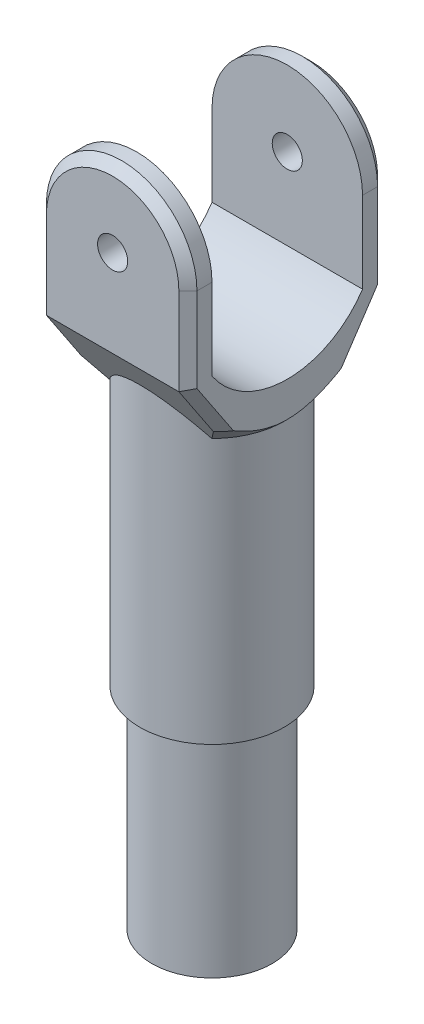
from build123d import *

# Parameters (mm, degrees)
SKETCH1_R               = 50
BOSS_EXTRUDE1_DEPTH     = 175
SKETCH4_R               = 60
BOSS_EXTRUDE3_DEPTH     = 250
BOSS_EXTRUDE4_DEPTH     = 62.5
CUT_EXTRUDE2_DEPTH      = 616.817546031
CUT_EXTRUDE2_DEPTH_BACK = 616.817546031
SKETCH6_R               = 12.5
CHAMFER2_SIZE           = 30
CHAMFER3_SIZE           = 7.5
CUT_EXTRUDE3_DEPTH      = 609.712781203
CUT_EXTRUDE3_DEPTH_BACK = 609.712781203


with BuildPart() as part:
    # Sketch1 → Boss-Extrude1 (new body)
    with BuildSketch(Plane(origin=(0, 0, 0), x_dir=(1, 0, 0), z_dir=(0, 1, 0))):
        with Locations(Location((0, 0, 0), (0, 0, 270))):
            Circle(SKETCH1_R)
    extrude(amount=BOSS_EXTRUDE1_DEPTH)

    # Sketch4 → Boss-Extrude3 (add)
    with BuildSketch(Plane(origin=(0, 175, 0), x_dir=(1, 0, 0), z_dir=(0, 1, 0))):
        with Locations(Location((0, 0, 0), (0, 0, 270))):
            Circle(SKETCH4_R)
    extrude(amount=BOSS_EXTRUDE3_DEPTH)

    # Sketch5 → Boss-Extrude4 (add, symmetric)
    with BuildSketch(Plane(origin=(0, 0, 0), x_dir=(0, 0, -1), z_dir=(1, 0, 0))):
        Polygon((-62.5, 425), (62.5, 425), (82.5, 455), (82.5, 590), (62.5, 590), (62.5, 460), (-62.5, 460), (-62.5, 590), (-82.5, 590), (-82.5, 455), align=None)
    extrude(amount=BOSS_EXTRUDE4_DEPTH, both=True)

    # Sketch6 → Cut-Extrude2 (cut, two sides: drawn at the far end of the back side and taken through both)
    with BuildSketch(Plane.XY.offset(82.5).offset(-CUT_EXTRUDE2_DEPTH_BACK)):
        with Locations(Location((0, 527.5, 0), (0, 0, 90))):
            Circle(SKETCH6_R)
        with BuildLine():
            Line((-62.5, 527.5), (-67.5, 527.5))
            Line((-67.5, 527.5), (-67.5, 595))
            Line((-67.5, 595), (67.5, 595))
            Line((67.5, 595), (67.5, 527.5))
            Line((67.5, 527.5), (62.5, 527.5))
            ThreePointArc((62.5, 527.5), (0, 590), (-62.5, 527.5))
        make_face()
    extrude(amount=CUT_EXTRUDE2_DEPTH + CUT_EXTRUDE2_DEPTH_BACK, mode=Mode.SUBTRACT)

    # Chamfer2
    # the kernel refuses this chamfer: 30 mm, written as the material it adds along each edge
    with BuildSketch(Plane(origin=(0, 425, 0), x_dir=(0, 0, 1), z_dir=(-1, 0, 0))) as chamfer2_piece_1_section:
        Polygon((60 + CHAMFER2_SIZE, 0), (60, -CHAMFER2_SIZE), (60, 0), align=None)
    chamfer2_piece_1 = revolve(axis=Axis((0, 425, 0), (0, 1, 0)), mode=Mode.PRIVATE)
    chamfer2_piece_1 = split(chamfer2_piece_1, bisect_by=Plane(origin=(-62.5, 399.085825085, 31.840161024), z_dir=(1, 0, 0)), keep=Keep.TOP, mode=Mode.PRIVATE)
    chamfer2_piece_1 = split(chamfer2_piece_1, bisect_by=Plane(origin=(54.930093835, 392.908722455, 41.10581497), z_dir=(0, 0.5547001962252294, -0.8320502943378435)), keep=Keep.TOP, mode=Mode.PRIVATE)
    chamfer2_piece_1 = split(chamfer2_piece_1, bisect_by=Plane(origin=(54.930093835, 363.517804586, -21.511869724), z_dir=(0, 0.5547001962252294, 0.8320502943378435)), keep=Keep.TOP, mode=Mode.PRIVATE)
    chamfer2_piece_1 = split(chamfer2_piece_1, bisect_by=Plane(origin=(62.5, 399.085825085, 31.840161024), z_dir=(-1, 0, 0)), keep=Keep.TOP, mode=Mode.PRIVATE)
    add(chamfer2_piece_1)

    # Chamfer3
    chamfer3_edges = [part.edges().sort_by_distance(p)[0] for p in [
        (-62.5, 438.486605007, 71.491070005),
        (-62.5, 438.486605007, -71.491070005),
        (-62.5, 491.25, -82.5),
        (62.5, 438.486605007, 71.491070005),
        (62.5, 438.486605007, -71.491070005),
        (62.5, 491.25, -82.5),
        (-62.5, 491.25, 82.5),
        (62.5, 491.25, 82.5),
        (0, 590, -82.5),
    ]]
    chamfer(chamfer3_edges, length=CHAMFER3_SIZE)

    # Sketch7 → Cut-Extrude3 (cut, two sides: drawn at the far end of the back side and taken through both)
    with BuildSketch(Plane.ZY.offset(62.5).offset(-CUT_EXTRUDE3_DEPTH_BACK)):
        with BuildLine():
            Line((-62.5, 460), (62.5, 460))
            ThreePointArc((62.5, 460), (0, 426.457809879), (-62.5, 460))
        make_face()
    extrude(amount=CUT_EXTRUDE3_DEPTH + CUT_EXTRUDE3_DEPTH_BACK, mode=Mode.SUBTRACT)


solid = part.part
